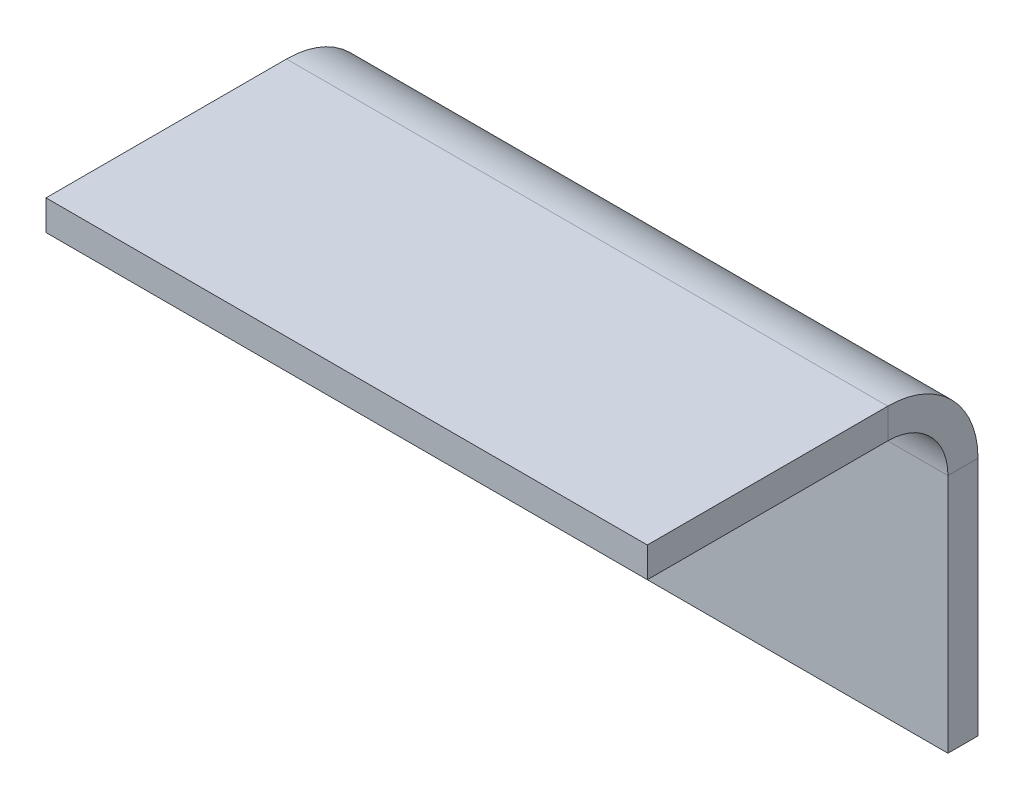
from build123d import *

# Parameters (mm, degrees)
SKETCH_1_W                 = 20
SKETCH_1_H                 = 10
BASEPLATE_DEPTH            = 1
EDGEFLANGE_STRIP_W         = 8
EDGEFLANGE_STRIP_H         = 1
EDGEFLANGE_STRIP_CUT_DEPTH = 20
EDGEFLANGE_DEPTH           = 20
EDGEFLANGE_START           = 1
EDGEFLANGE_FLAT_DEPTH      = 1


# Sheet-metal steps are written as plain solids
with BuildPart() as part:
    # Sketch 1 → BasePlate (new body)
    with BuildSketch(Plane.XY):
        with Locations((10, 5)):
            Rectangle(SKETCH_1_W, SKETCH_1_H)
    extrude(amount=-BASEPLATE_DEPTH)

    # EdgeFlange strip (across the edge) → EdgeFlange strip cut (cut)
    with BuildSketch(Plane(origin=(20, 10, 0), x_dir=(0, -1, 0), z_dir=(-1, 0, 0))):
        with Locations((-2, -0.5)):
            Rectangle(EDGEFLANGE_STRIP_W, EDGEFLANGE_STRIP_H)
    extrude(amount=EDGEFLANGE_STRIP_CUT_DEPTH, mode=Mode.SUBTRACT)

    # EdgeFlange bend section (across the edge) → EdgeFlange (add)
    with BuildSketch(Plane(origin=(20, 10, 0), x_dir=(0, -1, 0), z_dir=(-1, 0, 0))):
        with BuildLine():
            Line((-1, 2), (0, 2))
            ThreePointArc((0, 2), (0.585786438, 0.585786438), (2, 0))
            Line((2, 0), (2, -1))
            ThreePointArc((2, -1), (-0.121320344, -0.121320344), (-1, 2))
        make_face()
    extrude(amount=EDGEFLANGE_DEPTH)

    # EdgeFlange profile (on flange) → EdgeFlange flat (add)
    with BuildSketch(Plane(origin=(0, 10, 0), x_dir=(-1, 0, 0), z_dir=(0, 1, 0)).offset(EDGEFLANGE_START)):
        Polygon((-20, 10), (-20, 2), (0, 2), (0, 10), (-2, 10), (-18, 10), align=None)
    extrude(amount=-EDGEFLANGE_FLAT_DEPTH)


solid = part.part
